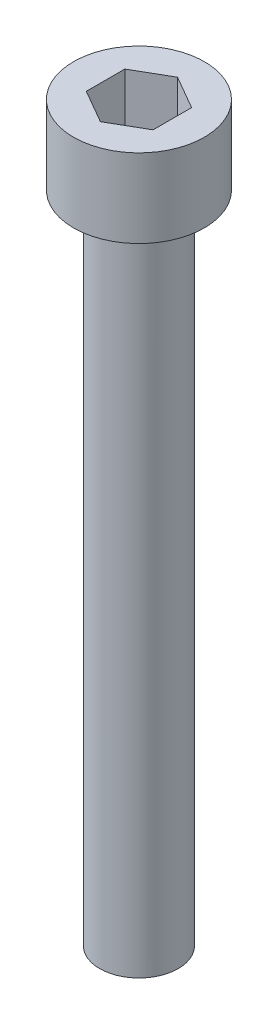
from build123d import *

# Parameters (mm, degrees)
SKETCH_1_R      = 5
EXTRUDE_1_DEPTH = 6
SKETCH_2_R      = 3
EXTRUDE_2_DEPTH = 50


with BuildPart() as part:
    # Эскиз1 → Вытянуть1 (new body)
    with BuildSketch(Plane(origin=(0, 0, 0), x_dir=(1, 0, 0), z_dir=(0, 1, 0))):
        Circle(SKETCH_1_R)
        Polygon((0, -2.944486373), (2.55, -1.472243186), (2.55, 1.472243186), (0, 2.944486373), (-2.55, 1.472243186), (-2.55, -1.472243186), align=None, mode=Mode.SUBTRACT)
    extrude(amount=EXTRUDE_1_DEPTH)

    # Эскиз2 → Вытянуть2 (add)
    with BuildSketch(Plane.XZ):
        Circle(SKETCH_2_R)
    extrude(amount=EXTRUDE_2_DEPTH)


solid = part.part
